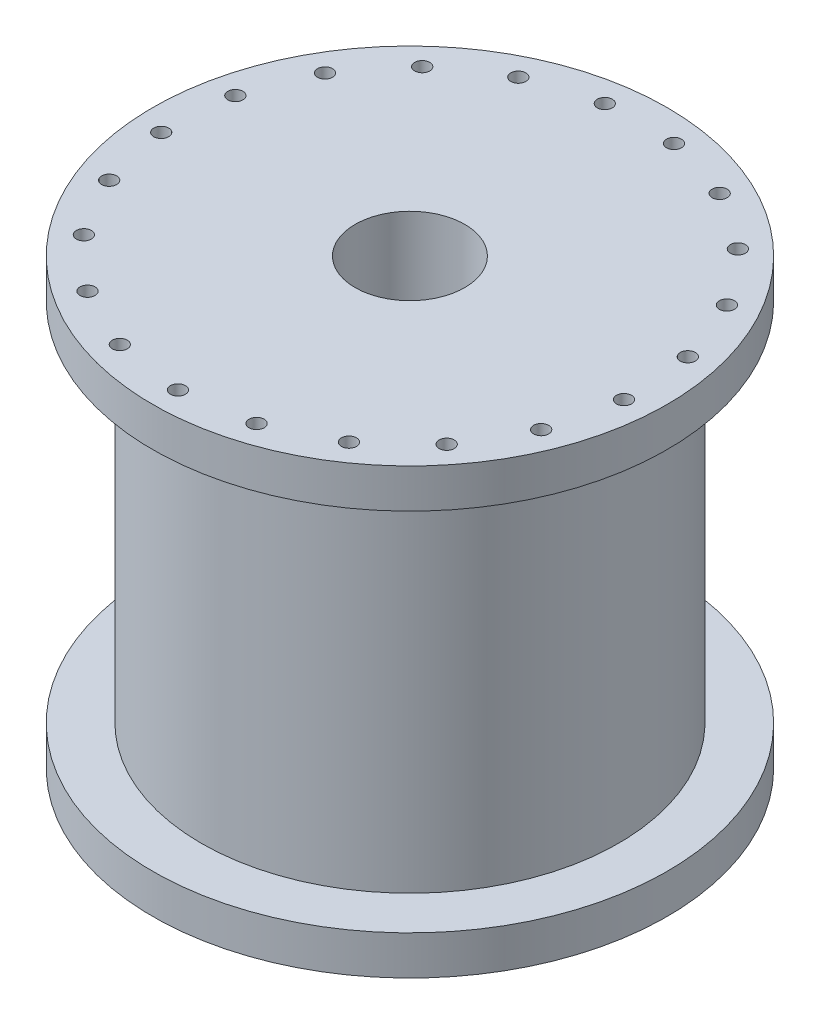
from build123d import *

# Parameters (mm, degrees)
SKETCH4_R          = 5.621513677
CUT_EXTRUDE1_DEPTH = 59.818372797
SKETCH5_R          = 0.771170088
CUT_EXTRUDE2_DEPTH = 56.773629073
CIRPATTERN2_COUNT  = 21


with BuildPart() as part:
    # Sketch3 → Revolve1 (revolve)
    with BuildSketch(Plane(origin=(0, 0, 0), x_dir=(0, 0, -1), z_dir=(1, 0, 0))):
        Polygon((0, 45.479433709), (0, 0), (26.374439217, 0), (26.374439217, 4.012873543), (21.395747074, 4.012873543), (21.395747074, 41.466560165), (26.374439217, 41.466560165), (26.374439217, 45.479433709), align=None)
    revolve(axis=Axis((0, 45.479433709, 0), (0, 1, 0)))

    # Sketch4 → Cut-Extrude1 (cut, through all)
    with BuildSketch(Plane(origin=(0, 45.479433709, 0), x_dir=(1, 0, 0), z_dir=(0, 1, 0))):
        Circle(SKETCH4_R)
    extrude(amount=-CUT_EXTRUDE1_DEPTH, mode=Mode.SUBTRACT)

    # Sketch5 → Cut-Extrude2 (cut, through all)
    with BuildSketch(Plane.XZ.offset(-41.466560165)):
        with Locations((0, 23.795144349)):
            Circle(SKETCH5_R)
    cut_extrude2 = extrude(amount=-CUT_EXTRUDE2_DEPTH, mode=Mode.SUBTRACT)

    # CirPattern2: Cut-Extrude2 ×21 about axis
    cirpattern2_axis = Axis((0, 0, 0), (0, 1, 0))
    for i in range(1, CIRPATTERN2_COUNT):
        add(cut_extrude2.rotate(cirpattern2_axis, i * 360 / CIRPATTERN2_COUNT), mode=Mode.SUBTRACT)


solid = part.part
